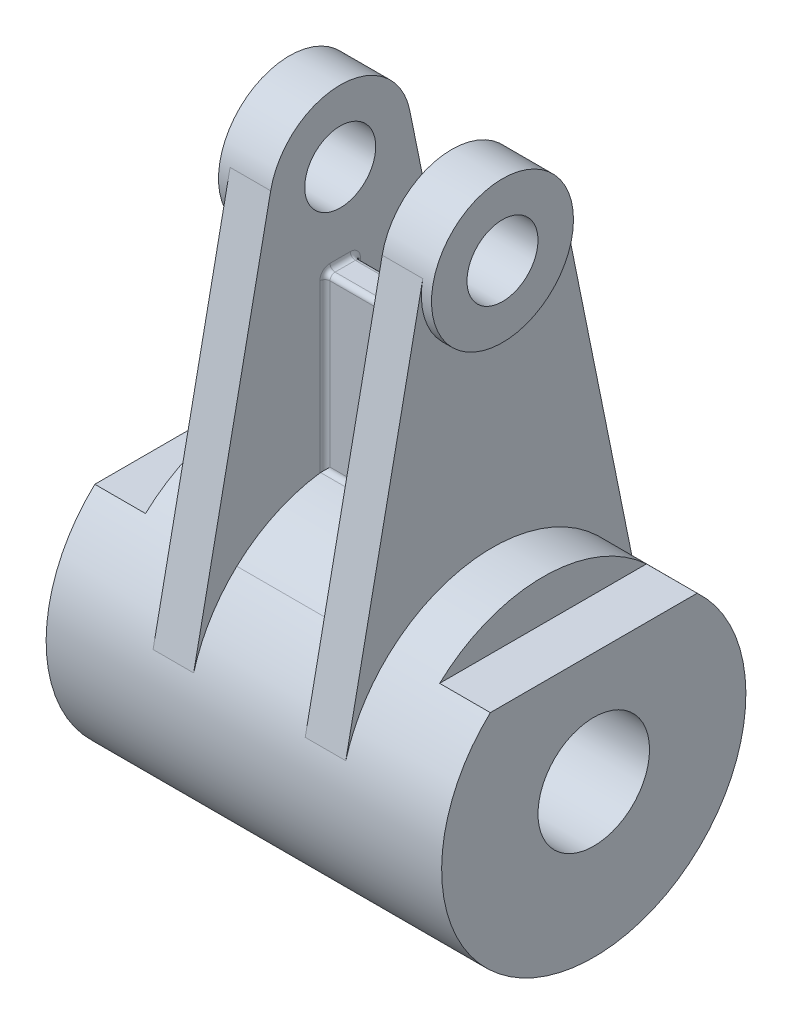
from build123d import *
from build123d.topology import SkipClean

# Parameters (mm, degrees)
SKETCH1_R           = 30
SKETCH1_R_2         = 11
BOSS_EXTRUDE1_DEPTH = 39
SKETCH2_R           = 18
CUT_EXTRUDE1_DEPTH  = 18
SKETCH3_R           = 8
CUT_EXTRUDE2_DEPTH  = 36
CUT_EXTRUDE3_DEPTH  = 10
BOSS_EXTRUDE2_START = -18
SKETCH5_R           = 14
SKETCH5_R_2         = 7
BOSS_EXTRUDE2_DEPTH = 10
BOSS_EXTRUDE3_START = -10
BOSS_EXTRUDE3_DEPTH = 8
BOSS_EXTRUDE4_START = -10
SKETCH6_R           = 14
SKETCH6_R_2         = 7
BOSS_EXTRUDE4_DEPTH = 10
BOSS_EXTRUDE7_REACH = 112.616
FILLET1_R           = 1
SKETCH10_R          = 3
CUT_EXTRUDE4_DEPTH  = 18
THREAD2_PITCH       = 1.5


with BuildPart() as part:
    # Sketch1 → Boss-Extrude1 (new, symmetric)
    with BuildSketch(Plane(origin=(0, 0, 0), x_dir=(0, 0, -1), z_dir=(1, 0, 0))):
        Circle(SKETCH1_R)
        Circle(SKETCH1_R_2, mode=Mode.SUBTRACT)
    extrude(amount=BOSS_EXTRUDE1_DEPTH, both=True)

    # Sketch2 → Cut-Extrude1 (cut, symmetric)
    with BuildSketch(Plane(origin=(0, 0, 0), x_dir=(0, 0, -1), z_dir=(1, 0, 0))):
        Circle(SKETCH2_R)
    extrude(amount=CUT_EXTRUDE1_DEPTH, both=True, mode=Mode.SUBTRACT)

    # Sketch3 → Cut-Extrude2 (cut)
    with BuildSketch(Plane(origin=(0, 0, 0), x_dir=(1, 0, 0), z_dir=(0, 1, 0))):
        with Locations(Location((0, 0, 0), (0, 0, 270))):
            Circle(SKETCH3_R)
    extrude(amount=-CUT_EXTRUDE2_DEPTH, mode=Mode.SUBTRACT)

    # Sketch4 → Cut-Extrude3 (cut)
    with BuildSketch(Plane(origin=(39, 0, 0), x_dir=(0, 0, -1), z_dir=(1, 0, 0))):
        with BuildLine():
            Line((-20.396078054, 22), (20.396078054, 22))
            ThreePointArc((20.396078054, 22), (0, 30), (-20.396078054, 22))
        make_face()
    cut_extrude3 = extrude(amount=-CUT_EXTRUDE3_DEPTH, mode=Mode.SUBTRACT)

    # Mirror1: Cut-Extrude3 across plane
    add(cut_extrude3.mirror(Plane(origin=(0, 0, 0), x_dir=(0, 0, 1), z_dir=(1, 0, 0))), mode=Mode.SUBTRACT)



with BuildPart() as body_2:
    # Sketch5 → Boss-Extrude2 (new body)
    with BuildSketch(Plane(origin=(29, 0, 0), x_dir=(0, 0, -1), z_dir=(1, 0, 0)).offset(BOSS_EXTRUDE2_START)):
        with Locations((0, 80)):
            Circle(SKETCH5_R)
        with Locations((0, 80)):
            Circle(SKETCH5_R_2, mode=Mode.SUBTRACT)
    extrude(amount=BOSS_EXTRUDE2_DEPTH)


with BuildPart() as part_1:
    add(part.part)

    add(body_2.part)  # Boss-Extrude3 merges body 2
    # Sketch5<3> → Boss-Extrude3 (add)
    with BuildSketch(Plane(origin=(29, 0, 0), x_dir=(0, 0, -1), z_dir=(1, 0, 0)).offset(BOSS_EXTRUDE3_START)):
        with BuildLine():
            ThreePointArc((-28.904862631, 8.031744288), (-18.152791402, 23.884642855), (0, 30))
            Line((0, 30), (0, 66))
            ThreePointArc((0, 66), (-10.840128245, 71.14045037), (-13.719807739, 82.78691148))
            Line((-13.719807739, 82.78691148), (-28.904862631, 8.031744288))
        make_face()
        with BuildLine():
            Line((0, 66), (0, 30))
            ThreePointArc((0, 30), (18.152791402, 23.884642855), (28.904862631, 8.031744288))
            Line((28.904862631, 8.031744288), (13.719807739, 82.78691148))
            ThreePointArc((13.719807739, 82.78691148), (13.929775812, 81.400480569), (14, 80))
            ThreePointArc((14, 80), (9.899494937, 70.100505063), (0, 66))
        make_face()
    boss_extrude3 = extrude(amount=-BOSS_EXTRUDE3_DEPTH)

    # Mirror6: Boss-Extrude3 across plane
    add(boss_extrude3.mirror(Plane(origin=(0, 0, 0), x_dir=(0, 0, 1), z_dir=(1, 0, 0))))

    # Sketch6 → Boss-Extrude4 (add)
    with BuildSketch(Plane(origin=(-11, 0, 0), x_dir=(0, 0, -1), z_dir=(1, 0, 0)).offset(BOSS_EXTRUDE4_START)):
        with Locations(Location((0, 80, 0), (0, 0, 168.51770571))):
            Circle(SKETCH6_R)
        with Locations((0, 80)):
            Circle(SKETCH6_R_2, mode=Mode.SUBTRACT)
    extrude(amount=BOSS_EXTRUDE4_DEPTH)

    # Sketch7 → Boss-Extrude7 (add, up to next)
    with BuildSketch(Plane.ZY.offset(-11), mode=Mode.PRIVATE) as boss_extrude7_sk1:
        with BuildLine():
            Line((-2.985410772, 29.851085785), (-2.985410772, 63.548153239))
            Line((-2.985410772, 63.548153239), (3.014589228, 63.548153239))
            Line((3.014589228, 63.548153239), (3.014589228, 29.848153239))
            ThreePointArc((3.014589228, 29.848153239), (0.014662725, 29.999996417), (-2.985410772, 29.851085785))
        make_face()
    boss_extrude7_tool1 = extrude(boss_extrude7_sk1.sketch, amount=BOSS_EXTRUDE7_REACH, mode=Mode.PRIVATE) - part_1.part
    add(boss_extrude7_tool1.solids().sort_by_distance((11, 46.749007, 0.014633))[0])

    # Fillet1
    fillet1_edges = [part_1.edges().sort_by_distance(p)[0] for p in [
        (-11, 46.698153239, 3.014589228),
        (-11, 63.548153239, 0.014589228),
        (-11, 46.699619512, -2.985410772),
        (0, 29.851085785, -2.985410772),
        (0, 63.548153239, -2.985410772),
        (11, 46.699619512, -2.985410772),
        (0, 29.848153239, 3.014589228),
        (11, 46.698153239, 3.014589228),
        (0, 63.548153239, 3.014589228),
        (11, 63.548153239, 0.014589228),
    ]]
    fillet(fillet1_edges, radius=FILLET1_R)

    # Sketch10 → Cut-Extrude4 (cut)
    with BuildSketch(Plane(origin=(0, 0, -2.985410772), x_dir=(-1, 0, 0), z_dir=(0, 0, -1))):
        with Locations((0, 48)):
            Circle(SKETCH10_R)
    extrude(amount=-CUT_EXTRUDE4_DEPTH, mode=Mode.SUBTRACT)

    # Thread2: the profile of Thread Profile3 profile screwed along a right-hand helix of 13.333333 turns, 8 arcs to a turn; built about Z, then put on its axis
    with SkipClean():  # the faces are left unmerged after this step: merging them gives an invalid solid
        thread2_z = Axis((0, 0, 0), (0, 0, 1))
        thread2_corners = [(2.9997, 0, -0.000173206), (3.811898813, 0, 0.468749998), (3.811898813, 0, 0.656249998), (2.9997, 0, 1.125173201)]
        with BuildLine(mode=Mode.PRIVATE) as thread2_profile:
            Line(thread2_corners[0], thread2_corners[1])
            Line(thread2_corners[1], thread2_corners[2])
            Line(thread2_corners[2], thread2_corners[3])
            Line(thread2_corners[3], thread2_corners[0])
        thread2_cap = Face(thread2_profile.wire())
        thread2_turn_angles = [0, 22.5, 45, 67.5, 90, 112.5, 135, 157.5, 180, 202.5, 225, 247.5, 270, 292.5, 315, 337.5, 360]
        thread2_turn_weights = [1, 0.9238795325112867, 1, 0.9238795325112867, 1, 0.9238795325112867, 1, 0.9238795325112867, 1, 0.9238795325112867, 1, 0.9238795325112867, 1, 0.9238795325112867, 1, 0.9238795325112867, 1]
        thread2_turn_rails = [Edge.make_bspline([Vector(p[0], p[1], 0).rotate(thread2_z, thread2_turn_angles[k]) / thread2_turn_weights[k] + Vector(0, 0, p[2] + THREAD2_PITCH * thread2_turn_angles[k] / 360) for k in range(17)], [0, 0, 0, 1, 1, 2, 2, 3, 3, 4, 4, 5, 5, 6, 6, 7, 7, 8, 8, 8], 2, thread2_turn_weights) for p in thread2_corners]
        thread2_turn_sides = [Face.make_surface_from_curves(thread2_turn_rails[p[0]], thread2_turn_rails[p[1]]) for p in [(0, 1), (1, 2), (2, 3), (3, 0)]]
        thread2_last_angles = [4680, 4702.5, 4725, 4747.5, 4770, 4785, 4800]
        thread2_last_weights = [1, 0.9238795325112867, 1, 0.9238795325112867, 1, 0.9659258262890703, 1]
        thread2_last_rails = [Edge.make_bspline([Vector(p[0], p[1], 0).rotate(thread2_z, thread2_last_angles[k]) / thread2_last_weights[k] + Vector(0, 0, p[2] + THREAD2_PITCH * thread2_last_angles[k] / 360) for k in range(7)], [0, 0, 0, 1, 1, 2, 2, 3, 3, 3], 2, thread2_last_weights) for p in thread2_corners]
        thread2_last_sides = [Face.make_surface_from_curves(thread2_last_rails[p[0]], thread2_last_rails[p[1]]) for p in [(0, 1), (1, 2), (2, 3), (3, 0)]]
        thread2 = Plane(origin=(0, 48, -2.985410772), x_dir=(1, 0, 0), z_dir=(0, 0, 1)) * Solid(Shell([*[p.moved(Location((0, 0, THREAD2_PITCH * i))) for i in range(13) for p in thread2_turn_sides], *thread2_last_sides, thread2_cap, thread2_cap.rotate(thread2_z, 4800).moved(Location((0, 0, THREAD2_PITCH * 4800 / 360)))]))
        add(thread2, mode=Mode.SUBTRACT)


solid = part_1.part
